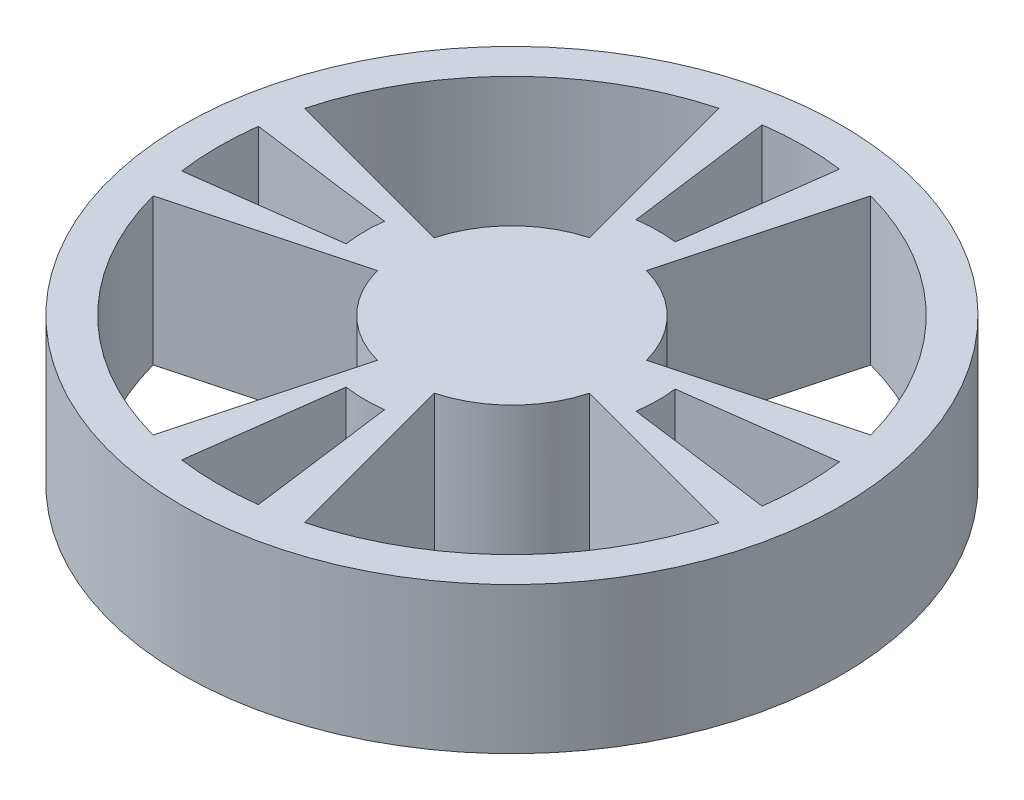
from build123d import *
from build123d.topology import SkipClean

# Parameters (mm, degrees)
SKETCH1_R           = 9.525
BOSS_EXTRUDE1_DEPTH = 2.54
SKETCH3_R           = 28.575
BOSS_EXTRUDE2_DEPTH = 12.7
CUT_EXTRUDE2_DEPTH  = 44.189337226
CUT_EXTRUDE3_DEPTH  = 8.466666667


with BuildPart() as part:
    # Sketch1 → Boss-Extrude1 (new body)
    with BuildSketch(Plane(origin=(0, 0, 0), x_dir=(1, 0, 0), z_dir=(0, 1, 0))):
        Circle(SKETCH1_R)
    extrude(amount=BOSS_EXTRUDE1_DEPTH)

    # Sketch3 → Boss-Extrude2 (add)
    with SkipClean():  # the faces are left unmerged after this step: merging them gives an invalid solid
        with BuildSketch(Plane(origin=(0, 2.54, 0), x_dir=(1, 0, 0), z_dir=(0, 1, 0))):
            Circle(SKETCH3_R)
            with BuildLine():
                Line((-2.465251405, 9.200443495), (-6.574003746, 24.534515988))
                ThreePointArc((-6.574003746, 24.534515988), (-17.960512242, 17.960512242), (-24.534515988, 6.574003746))
                Line((-24.534515988, 6.574003746), (-9.200443495, 2.465251405))
                ThreePointArc((-9.200443495, 2.465251405), (-6.735192091, 6.735192091), (-2.465251405, 9.200443495))
            make_face(mode=Mode.SUBTRACT)
            with BuildLine():
                Line((9.200443495, 2.465251405), (24.534515988, 6.574003746))
                ThreePointArc((24.534515988, 6.574003746), (17.960512242, 17.960512242), (6.574003746, 24.534515988))
                Line((6.574003746, 24.534515988), (2.465251405, 9.200443495))
                ThreePointArc((2.465251405, 9.200443495), (6.735192091, 6.735192091), (9.200443495, 2.465251405))
            make_face(mode=Mode.SUBTRACT)
            with BuildLine():
                Line((9.200443495, -2.465251405), (24.534515988, -6.574003746))
                ThreePointArc((24.534515988, -6.574003746), (17.960512242, -17.960512242), (6.574003746, -24.534515988))
                Line((6.574003746, -24.534515988), (2.465251405, -9.200443495))
                ThreePointArc((2.465251405, -9.200443495), (6.735192091, -6.735192091), (9.200443495, -2.465251405))
            make_face(mode=Mode.SUBTRACT)
            with BuildLine():
                Line((-9.200443495, -2.465251405), (-24.534515988, -6.574003746))
                ThreePointArc((-24.534515988, -6.574003746), (-17.960512242, -17.960512242), (-6.574003746, -24.534515988))
                Line((-6.574003746, -24.534515988), (-2.465251405, -9.200443495))
                ThreePointArc((-2.465251405, -9.200443495), (-6.735192091, -6.735192091), (-9.200443495, -2.465251405))
            make_face(mode=Mode.SUBTRACT)
        extrude(amount=BOSS_EXTRUDE2_DEPTH)

    # Sketch4 → Cut-Extrude2 (cut, through all)
    with SkipClean():  # the faces are left unmerged after this step: merging them gives an invalid solid
        with BuildSketch(Plane(origin=(0, 15.24, 0), x_dir=(1, 0, 0), z_dir=(0, 1, 0))):
            with BuildLine():
                Line((12.604555768, 1.554082971), (25.196118384, 3.211793638))
                ThreePointArc((25.196118384, 3.211793638), (25.399675108, -0.128469484), (25.162340107, -3.466502611))
                Line((25.162340107, -3.466502611), (12.570536445, -1.80876021))
                ThreePointArc((12.570536445, -1.80876021), (12.699350202, -0.128469656), (12.604555768, 1.554082971))
            make_face()
            with BuildLine():
                Line((-12.604555768, 1.554082971), (-25.196118384, 3.211793638))
                ThreePointArc((-25.196118384, 3.211793638), (-25.399675108, -0.128469484), (-25.162340107, -3.466502611))
                Line((-25.162340107, -3.466502611), (-12.570536445, -1.80876021))
                ThreePointArc((-12.570536445, -1.80876021), (-12.699350202, -0.128469656), (-12.604555768, 1.554082971))
            make_face()
            with BuildLine():
                Line((1.554082971, 12.604555768), (3.211793638, 25.196118384))
                ThreePointArc((3.211793638, 25.196118384), (-0.128469484, 25.399675108), (-3.466502611, 25.162340107))
                Line((-3.466502611, 25.162340107), (-1.80876021, 12.570536445))
                ThreePointArc((-1.80876021, 12.570536445), (-0.128469656, 12.699350202), (1.554082971, 12.604555768))
            make_face()
            with BuildLine():
                Line((-1.80876021, -12.570536445), (-3.466502611, -25.162340107))
                ThreePointArc((-3.466502611, -25.162340107), (-0.128469484, -25.399675108), (3.211793638, -25.196118384))
                Line((3.211793638, -25.196118384), (1.554082971, -12.604555768))
                ThreePointArc((1.554082971, -12.604555768), (-0.128469656, -12.699350202), (-1.80876021, -12.570536445))
            make_face()
        extrude(amount=-CUT_EXTRUDE2_DEPTH, mode=Mode.SUBTRACT)

    # Sketch2 → Cut-Extrude3 (cut)
    with SkipClean():  # the faces are left unmerged after this step: merging them gives an invalid solid
        with BuildSketch(Plane(origin=(0, 0, 0), x_dir=(1, 0, 0), z_dir=(0, 1, 0))):
            Polygon((-4.552853785, 1.885853785), (-1.885853785, 4.552853785), (0, 2.667), (1.885853785, 4.552853785), (4.552853785, 1.885853785), (2.667, 0), (4.552853785, -1.885853785), (1.885853785, -4.552853785), (0, -2.667), (-1.885853785, -4.552853785), (-4.552853785, -1.885853785), (-2.667, 0), align=None)
        extrude(amount=CUT_EXTRUDE3_DEPTH, mode=Mode.SUBTRACT)


solid = part.part
